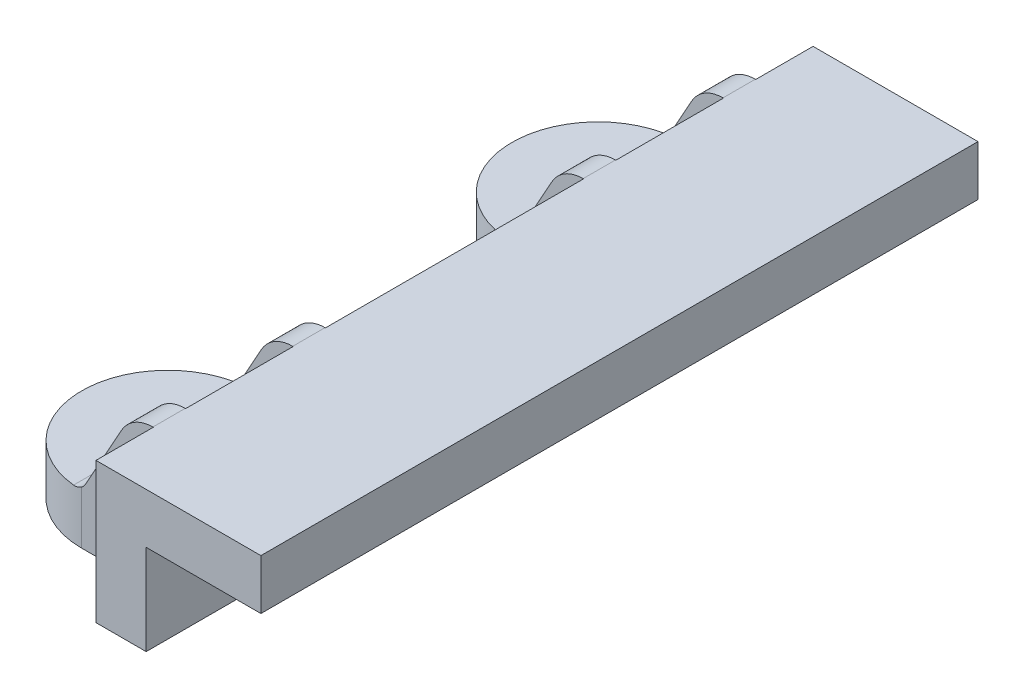
from build123d import *

# Parameters (mm, degrees)
SALIENTE_EXTRUIR1_DEPTH  = 25
CROQUIS2_R               = 2.25
SALIENTE_EXTRUIR2_DEPTH  = 3.5
SALIENTE_EXTRUIR3_DEPTH  = 2.25
REDONDEO3_R              = 1
REDONDEO5_R              = 2.5
REDONDEO3_OF_SIMETR_A1_R = 1
REDONDEO5_OF_SIMETR_A1_R = 2.5
REDONDEO3_OF_SIMETR_A4_R = 1
REDONDEO5_OF_SIMETR_A4_R = 2.5
SALIENTE_EXTRUIR4_DEPTH  = 2.25
REDONDEO6_R              = 2.5
REDONDEO7_R              = 1


with BuildPart() as part:
    # Croquis1 → Saliente-Extruir1 (new, symmetric)
    with BuildSketch(Plane.XY):
        Polygon((0, 0), (0, 9.8), (11.5, 9.8), (11.5, 6.3), (3.5, 6.3), (3.5, 0), align=None)
    extrude(amount=SALIENTE_EXTRUIR1_DEPTH, both=True)

    # Croquis2 → Saliente-Extruir2 (add)
    with BuildSketch(Plane(origin=(0, 0, 0), x_dir=(1, 0, 0), z_dir=(0, 1, 0))):
        with BuildLine():
            Line((0, 9), (-5, 9))
            ThreePointArc((-5, 9), (-11, 15), (-5, 21))
            Line((-5, 21), (0, 21))
            Line((0, 21), (0, 9))
        make_face()
        with Locations((-4.75, 15)):
            Circle(CROQUIS2_R, mode=Mode.SUBTRACT)
    saliente_extruir2 = extrude(amount=SALIENTE_EXTRUIR2_DEPTH)

    # Croquis3 → Saliente-Extruir3 (add)
    with BuildSketch(Plane.XY.offset(-9)):
        Polygon((0, 9.8), (0, 3.5), (-5, 3.5), (-1.5, 9.8), align=None)
    saliente_extruir3 = extrude(amount=-SALIENTE_EXTRUIR3_DEPTH)

    # Redondeo3
    redondeo3_edges = [part.edges().sort_by_distance(p)[0] for p in [
        (-5, 3.5, -10.125),
    ]]
    fillet(redondeo3_edges, radius=REDONDEO3_R)

    # Redondeo5
    redondeo5_edges = [part.edges().sort_by_distance(p)[0] for p in [
        (-1.5, 9.8, -10.125),
    ]]
    fillet(redondeo5_edges, radius=REDONDEO5_R)

    # Simetría1: Saliente-Extruir3 across plane
    add(saliente_extruir3.mirror(Plane(origin=(0, 0, -15), x_dir=(1, 0, 0), z_dir=(0, 0, -1))))

    # Redondeo3 of Simetría1
    redondeo3_of_simetr_a1_edges = [part.edges().sort_by_distance(p)[0] for p in [
        (-5, 3.5, -19.875),
    ]]
    fillet(redondeo3_of_simetr_a1_edges, radius=REDONDEO3_OF_SIMETR_A1_R)

    # Redondeo5 of Simetría1
    redondeo5_of_simetr_a1_edges = [part.edges().sort_by_distance(p)[0] for p in [
        (-1.5, 9.8, -19.875),
    ]]
    fillet(redondeo5_of_simetr_a1_edges, radius=REDONDEO5_OF_SIMETR_A1_R)

    # Simetría4: Saliente-Extruir2, Saliente-Extruir3 across plane
    add(saliente_extruir2.mirror(Plane.XY))
    add(saliente_extruir3.mirror(Plane.XY))

    # Redondeo3 of Simetría4
    redondeo3_of_simetr_a4_edges = [part.edges().sort_by_distance(p)[0] for p in [
        (-5, 3.5, 10.125),
    ]]
    fillet(redondeo3_of_simetr_a4_edges, radius=REDONDEO3_OF_SIMETR_A4_R)

    # Redondeo5 of Simetría4
    redondeo5_of_simetr_a4_edges = [part.edges().sort_by_distance(p)[0] for p in [
        (-1.5, 9.8, 10.125),
    ]]
    fillet(redondeo5_of_simetr_a4_edges, radius=REDONDEO5_OF_SIMETR_A4_R)

    # Croquis4 → Saliente-Extruir4 (add)
    with BuildSketch(Plane.XY.offset(21)):
        Polygon((0, 3.5), (-5, 3.5), (-1.5, 9.8), (0, 9.8), align=None)
    extrude(amount=-SALIENTE_EXTRUIR4_DEPTH)

    # Redondeo6
    redondeo6_edges = [part.edges().sort_by_distance(p)[0] for p in [
        (-1.5, 9.8, 19.875),
    ]]
    fillet(redondeo6_edges, radius=REDONDEO6_R)

    # Redondeo7
    redondeo7_edges = [part.edges().sort_by_distance(p)[0] for p in [
        (-5, 3.5, 19.875),
    ]]
    fillet(redondeo7_edges, radius=REDONDEO7_R)


solid = part.part
